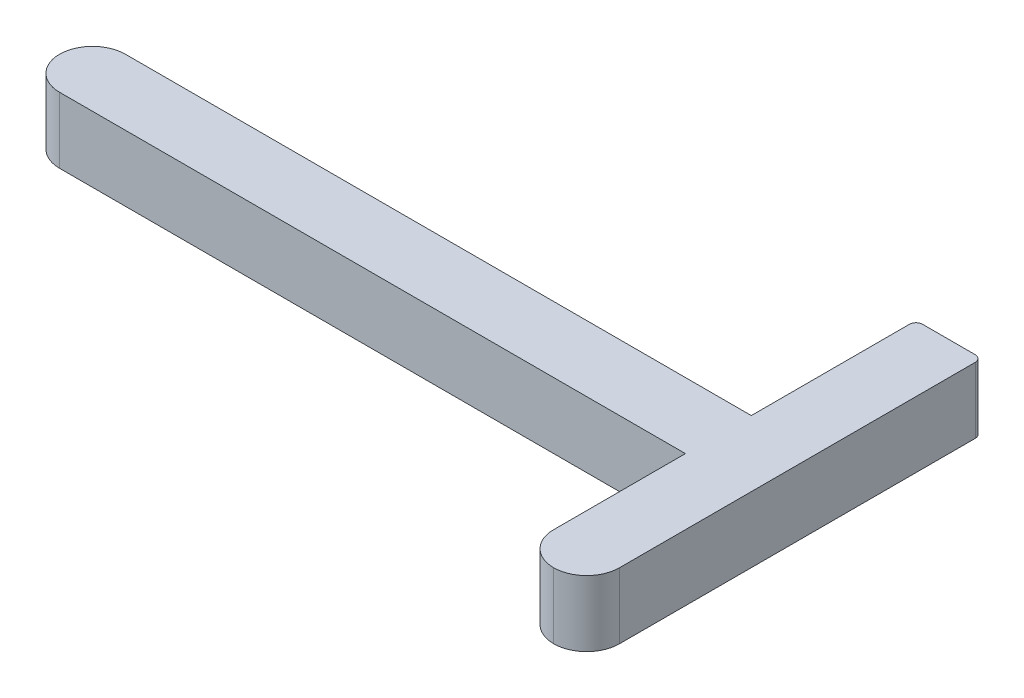
from build123d import *

# Parameters (mm, degrees)
BOSS_EXTRU_1_DEPTH      = 10
CONG_3_R                = 5
CONG_4_R                = 5
CONG_5_R                = 1
CONG_6_R                = 1
ENL_V_MAT_EXTRU_1_DEPTH = 30


with BuildPart() as part:
    # Esquisse1 → Boss.-Extru.1 (new body)
    with BuildSketch(Plane(origin=(0, 0, 0), x_dir=(1, 0, 0), z_dir=(0, 1, 0))):
        Polygon((50, 30), (50, 5), (-50, 5), (-50, -5), (50, -5), (50, -30), (60, -30), (60, 30), align=None)
    extrude(amount=BOSS_EXTRU_1_DEPTH)

    # Congé3
    cong_3_edges = [part.edges().sort_by_distance(p)[0] for p in [
        (60, 5, 30),
        (50, 5, 30),
    ]]
    fillet(cong_3_edges, radius=CONG_3_R - 0.0001)  # a hair under: the kernel refuses the full size

    # Congé4
    cong_4_edges = [part.edges().sort_by_distance(p)[0] for p in [
        (-50, 5, 5),
        (-50, 5, -5),
    ]]
    fillet(cong_4_edges, radius=CONG_4_R - 0.0001)  # a hair under: the kernel refuses the full size

    # Congé5
    cong_5_edges = [part.edges().sort_by_distance(p)[0] for p in [
        (50, 5, -30),
    ]]
    fillet(cong_5_edges, radius=CONG_5_R)

    # Congé6
    cong_6_edges = [part.edges().sort_by_distance(p)[0] for p in [
        (60, 5, -30),
    ]]
    fillet(cong_6_edges, radius=CONG_6_R)

    # Esquisse3D1 → Enlèv. mat.-Extru.1 (cut)
    with BuildSketch(Plane(origin=(-50, 4.5, -1.5), x_dir=(0, 0.3162277660168382, 0.9486832980505138), z_dir=(-1, 0, 0))):
        Polygon((0, 0), (2.846049894, -0.948683298), (3.16227766, 0), (0.316227766, 0.948683298), align=None)
    extrude(amount=-ENL_V_MAT_EXTRU_1_DEPTH, mode=Mode.SUBTRACT)


solid = part.part
